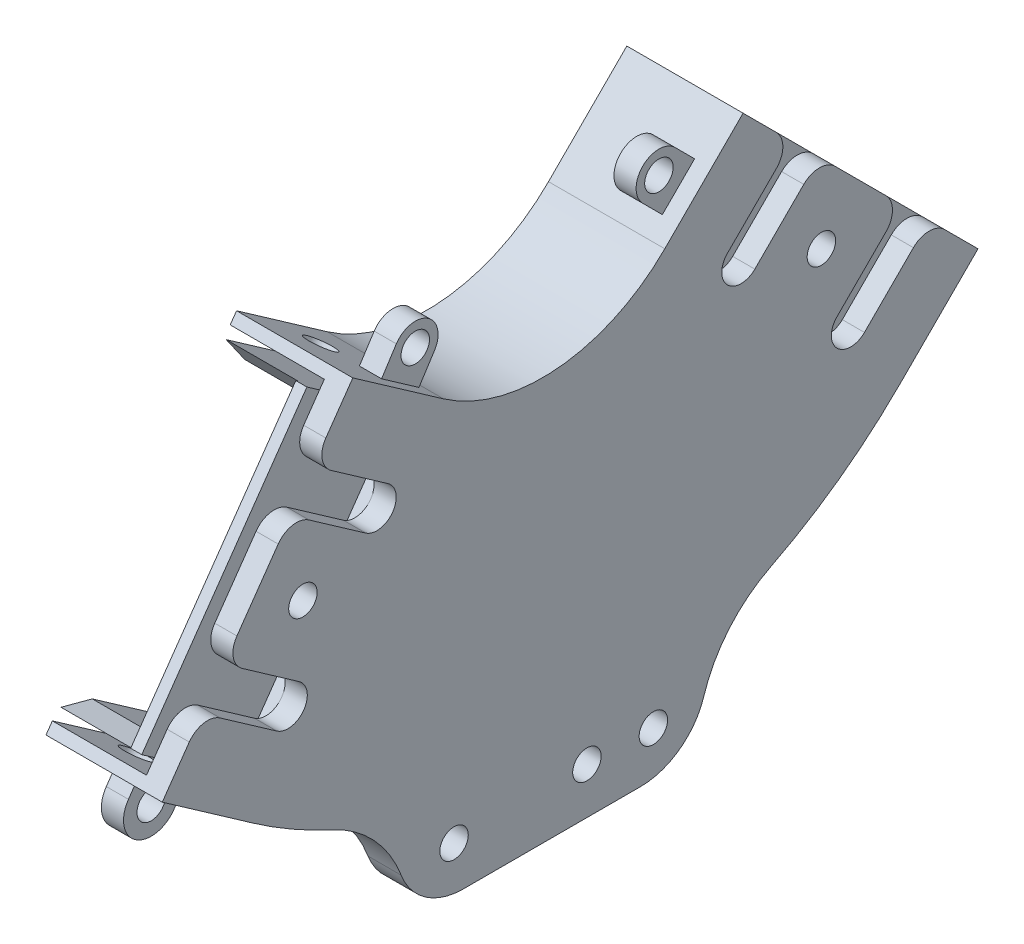
from build123d import *
from build123d.topology import SkipClean

# Parameters (mm, degrees)
BASE_EXTRUDE_DEPTH              = 58.42
BASE_EXTRUDE_2_DEPTH            = 58.42
OUTER_WALL_DEPTH                = 7.62
SKETCH6_W                       = 73.66
SKETCH6_H                       = 76.2
SKETCH6_W_2                     = 68.58
SKETCH6_H_2                     = 71.12
SKETCH6_W_3                     = 63.5
SKETCH6_H_3                     = 66.04
SKETCH6_W_4                     = 58.42
SKETCH6_H_4                     = 60.96
ENDCAP_1_DEPTH                  = 25.4
SKETCH7_W                       = 73.66
SKETCH7_H                       = 76.2
SKETCH7_W_2                     = 68.58
SKETCH7_H_2                     = 71.12
SKETCH7_W_3                     = 63.5
SKETCH7_H_3                     = 66.04
SKETCH7_W_4                     = 58.42
SKETCH7_H_4                     = 60.96
ENDCAP_2_DEPTH                  = 25.4
INTERNAL_CHAMFER_SIZE           = 2.773453185
INTERNAL_CHAMFER_SIZE_2         = 7.62
FLYWHEEL_HOLE_REACH             = 158.41
SKETCH10_W                      = 25.4
SKETCH10_H                      = 177.72143494
SKETCH11_R                      = 4.064
SKETCH11_R_2                    = 2.5
FLYWHEEL_HOLDER_DEPTH           = 7.62
SKETCH12_R                      = 14.605
MOTOR_INSERT_DEPTH              = 6.35
SKETCH14_W                      = 212.132210094
SKETCH14_H                      = 160.972819264
CUT_EXTRUDE2_DEPTH              = 49.53
SKETCH15_R                      = 3.2639
JOINING_SCREW_HOLES_DEPTH       = 5.08
SKETCH16_R                      = 3.2639
FLYWHEEL_COVER_CONNECTORS_DEPTH = 5.08
F_80_20_START                   = -5.08
SKETCH17_R                      = 3.2639
F_80_20_CONNECTOR_DEPTH         = 5.08
FILLET1_R                       = 30.48
FILLET2_R                       = 15.24
SUPPORT_REMOVAL_REACH           = 169.33
FILLET3_R                       = 5.08
CUT_EXTRUDE3_REACH              = 169.33
SKETCH19_R                      = 3.2639
CUT_EXTRUDE4_REACH              = 200.014
SKETCH20_R                      = 3.2639
CUT_EXTRUDE5_REACH              = 197.272
SKETCH21_R                      = 3.2639
SKETCH22_R                      = 3.2639
BOSS_EXTRUDE1_DEPTH             = 2.54


with BuildPart() as part:
    # Sketch3 → Base extrude (new body)
    with BuildSketch(Plane(origin=(0, 0, 0), x_dir=(0, 0, -1), z_dir=(1, 0, 0))):
        with BuildLine():
            Line((-62.063264719, -88.6355278), (-66.433917164, -94.877466378))
            ThreePointArc((-66.433917164, -94.877466378), (10.094726748, -115.383254712), (81.899935824, -81.899935824))
            Line((81.899935824, -81.899935824), (76.511782152, -76.511782152))
            ThreePointArc((76.511782152, -76.511782152), (9.430599988, -107.792251112), (-62.063264719, -88.6355278))
        make_face()
    extrude(amount=BASE_EXTRUDE_DEPTH)



with BuildPart() as body_2:
    # Sketch3 → Base extrude 2 (new body)
    with BuildSketch(Plane(origin=(0, 0, 0), x_dir=(0, 0, -1), z_dir=(1, 0, 0))):
        with BuildLine():
            ThreePointArc((28.018399098, -28.018399098), (3.453459151, -39.473218717), (-22.727392714, -32.458080603))
            Line((-22.727392714, -32.458080603), (-27.098045159, -38.70001918))
            ThreePointArc((-27.098045159, -38.70001918), (4.11758591, -47.064222317), (33.40655277, -33.40655277))
            Line((33.40655277, -33.40655277), (28.018399098, -28.018399098))
        make_face()
    extrude(amount=BASE_EXTRUDE_2_DEPTH)


with BuildPart() as part_1:
    add(part.part)

    add(body_2.part)  # Outer wall merges body 2
    # Sketch4 → Outer wall (add)
    with BuildSketch(Plane(origin=(58.42, 0, 0), x_dir=(0, 0, -1), z_dir=(1, 0, 0))):
        with BuildLine():
            Line((-66.433917164, -94.877466378), (-22.727392714, -32.458080603))
            ThreePointArc((-22.727392714, -32.458080603), (3.453459151, -39.473218717), (28.018399098, -28.018399098))
            Line((28.018399098, -28.018399098), (81.899935824, -81.899935824))
            ThreePointArc((81.899935824, -81.899935824), (10.094726748, -115.383254712), (-66.433917164, -94.877466378))
        make_face()
    outer_wall = extrude(amount=OUTER_WALL_DEPTH)

    # Mirror1: Outer wall across plane
    add(outer_wall.mirror(Plane.ZY.offset(-29.21)))

    # Sketch6 → Endcap 1 (add)
    # profile 1 of 2: a face of its own
    with BuildSketch(Plane(origin=(0, 0, 0), x_dir=(1, 0, 0), z_dir=(0, 0.5735764363510462, 0.8191520442889917))):
        with Locations((29.21, -77.724)):
            Rectangle(SKETCH6_W, SKETCH6_H)
        with Locations((29.21, -77.724)):
            Rectangle(SKETCH6_W_2, SKETCH6_H_2, mode=Mode.SUBTRACT)
    # profile 2 of 2: a face of its own
    with BuildSketch(Plane(origin=(0, 0, 0), x_dir=(1, 0, 0), z_dir=(0, 0.5735764363510462, 0.8191520442889917))):
        with Locations((29.21, -77.724)):
            Rectangle(SKETCH6_W_3, SKETCH6_H_3)
        with Locations((29.21, -77.724)):
            Rectangle(SKETCH6_W_4, SKETCH6_H_4, mode=Mode.SUBTRACT)
    extrude(amount=ENDCAP_1_DEPTH)

    # Sketch7 → Endcap 2 (add)
    # profile 1 of 2: a face of its own
    with BuildSketch(Plane(origin=(0, 0, 0), x_dir=(1, 0, 0), z_dir=(0, 0.7071067811865503, -0.7071067811865447))):
        with Locations((29.21, 77.724)):
            Rectangle(SKETCH7_W, SKETCH7_H)
        with Locations((29.21, 77.724)):
            Rectangle(SKETCH7_W_2, SKETCH7_H_2, mode=Mode.SUBTRACT)
    # profile 2 of 2: a face of its own
    with BuildSketch(Plane(origin=(0, 0, 0), x_dir=(1, 0, 0), z_dir=(0, 0.7071067811865503, -0.7071067811865447))):
        with Locations((29.21, 77.724)):
            Rectangle(SKETCH7_W_3, SKETCH7_H_3)
        with Locations((29.21, 77.724)):
            Rectangle(SKETCH7_W_4, SKETCH7_H_4, mode=Mode.SUBTRACT)
    extrude(amount=ENDCAP_2_DEPTH)

    # Internal Chamfer
    # the kernel refuses this chamfer: 7.62, 2.773453185 mm, written as the material it takes off along each edge
    with BuildSketch(Plane(origin=(58.42, -15.446040528, -51.367065013), x_dir=(0, 0.7736626875489875, 0.6335977003544738), z_dir=(-1, 0, 0)), Plane(origin=(0, -24.131177697, 47.904507084), x_dir=(0, 0.8719320989550161, -0.489626811778011), z_dir=(1, 0, 0))) as internal_chamfer_piece_1:
        Polygon((INTERNAL_CHAMFER_SIZE * 0.995083363221, -INTERNAL_CHAMFER_SIZE * 0.0990409022559), (-INTERNAL_CHAMFER_SIZE_2 * 0.0990409022521, -INTERNAL_CHAMFER_SIZE_2 * 0.995083363182), (0, 0), align=None)
    extrude(amount=58.42, mode=Mode.SUBTRACT)
    with BuildSketch(Plane(origin=(0, -58.551269909, -94.472294394), x_dir=(0, -0.6977227871251116, 0.7163678610367485), z_dir=(1, 0, 0)), Plane(origin=(58.42, -74.066686317, 82.869726644), x_dir=(0, -0.562726836605906, -0.8266429140587307), z_dir=(-1, 0, 0))) as internal_chamfer_piece_2:
        Polygon((INTERNAL_CHAMFER_SIZE_2 * 0.999913086528, INTERNAL_CHAMFER_SIZE_2 * 0.0131840581986), (-INTERNAL_CHAMFER_SIZE * 0.0131840581992, INTERNAL_CHAMFER_SIZE * 0.999913086567), (0, 0), align=None)
    extrude(amount=58.42, mode=Mode.SUBTRACT)

    # Sketch10 → Flywheel Hole (cut, up to next)
    with BuildSketch(Plane(origin=(0, -13.973562988, -1.22252835), x_dir=(-1, 0, 0), z_dir=(0, -0.9961946980917453, -0.08715574274766034)), mode=Mode.PRIVATE) as flywheel_hole_sk1:
        with Locations((-29.21, 6.675062398)):
            Rectangle(SKETCH10_W, SKETCH10_H)
    flywheel_hole_tool1 = extrude(flywheel_hole_sk1.sketch, amount=FLYWHEEL_HOLE_REACH, mode=Mode.PRIVATE) & part_1.part
    add(flywheel_hole_tool1.solids().sort_by_distance((29.21, -13.391793, -7.87219))[0], mode=Mode.SUBTRACT)

    # Sketch11 → Flywheel holder (add)
    with BuildSketch(Plane.ZY.offset(7.62)):
        with BuildLine():
            Line((-25.298191602, 2.271893855), (-28.018399098, -28.018399098))
            ThreePointArc((-28.018399098, -28.018399098), (-17.263469888, -35.665585421), (-4.593712298, -39.356818765))
            Line((-4.593712298, -39.356818765), (-3.063575879, -22.31830958))
            ThreePointArc((-3.063575879, -22.31830958), (1.55249301, -17.71209094), (6.899502357, -21.445029888))
            Line((6.899502357, -21.445029888), (11.370438714, -37.957535477))
            ThreePointArc((11.370438714, -37.957535477), (17.269236463, -35.662793609), (22.727392714, -32.458080603))
            Line((22.727392714, -32.458080603), (33.130623676, -25.173659861))
            Line((33.130623676, -25.173659861), (24.517199578, 6.638292315))
            ThreePointArc((24.517199578, 6.638292315), (-2.217847157, 25.302987057), (-25.298191602, 2.271893855))
        make_face()
        Circle(SKETCH11_R, mode=Mode.SUBTRACT)
        with Locations((-20.421702152, -1.789994753)):
            Circle(SKETCH11_R_2, mode=Mode.SUBTRACT)
        with Locations((20.421702152, 1.789994753)):
            Circle(SKETCH11_R_2, mode=Mode.SUBTRACT)
    extrude(amount=-FLYWHEEL_HOLDER_DEPTH)

    # Sketch12 → Motor insert (cut)
    with BuildSketch(Plane.ZY.offset(7.62)):
        Circle(SKETCH12_R)
    extrude(amount=-MOTOR_INSERT_DEPTH, mode=Mode.SUBTRACT)

    # Sketch14 → Cut-Extrude2 (cut)
    with BuildSketch(Plane.ZY.offset(7.62)):
        with Locations((-0.510154839, -39.532122181)):
            Rectangle(SKETCH14_W, SKETCH14_H)
    extrude(amount=-CUT_EXTRUDE2_DEPTH, mode=Mode.SUBTRACT)

    # Sketch15 → Joining screw holes (add)
    # profile 1 of 3: a face of its own
    with BuildSketch(Plane.ZY.offset(-41.91)):
        with BuildLine():
            Line((-89.621167975, -74.178703673), (-93.808320694, -77.730793631))
            ThreePointArc((-93.808320694, -77.730793631), (-94.293535912, -86.957846302), (-85.053908121, -86.901162291))
            Line((-85.053908121, -86.901162291), (-80.631239272, -83.149276783))
            ThreePointArc((-80.631239272, -83.149276783), (-81.267988364, -82.527044314), (-81.899935824, -81.899935824))
            Line((-81.899935824, -81.899935824), (-89.621167975, -74.178703673))
        make_face()
        with Locations(Location((-89.700448066, -82.573094993, 0), (0, 0, 270))):
            Circle(SKETCH15_R, mode=Mode.SUBTRACT)
    # profile 2 of 3: a face of its own
    with BuildSketch(Plane.ZY.offset(-41.91)):
        with BuildLine():
            ThreePointArc((-3.85934265, -115.759684045), (-10.200012116, -115.373995029), (-16.51, -114.641261664))
            Line((-16.51, -114.641261664), (-16.51, -121.49592915))
            ThreePointArc((-16.51, -121.49592915), (-9.764193336, -127.833581482), (-3.85934265, -120.705855126))
            Line((-3.85934265, -120.705855126), (-3.85934265, -115.759684045))
        make_face()
        with Locations(Location((-10.16, -121.49592915, 0), (0, 0, 270))):
            Circle(SKETCH15_R, mode=Mode.SUBTRACT)
    # profile 3 of 3: a face of its own
    with BuildSketch(Plane.ZY.offset(-41.91)):
        with BuildLine():
            ThreePointArc((66.433917164, -94.877466378), (62.923155577, -97.241325928), (59.32837287, -99.475339399))
            Line((59.32837287, -99.475339399), (62.868028779, -104.530491931))
            Line((62.868028779, -104.530491931), (63.115503756, -104.883922825))
            ThreePointArc((63.115503756, -104.883922825), (71.906047644, -106.216498213), (73.412285238, -97.454040377))
            Line((73.412285238, -97.454040377), (73.371541167, -97.395851813))
            Line((73.371541167, -97.395851813), (69.905878638, -92.446372781))
            Line((69.905878638, -92.446372781), (66.433917164, -94.877466378))
        make_face()
        with Locations(Location((68.190379089, -101.067099492, 0), (0, 0, 270))):
            Circle(SKETCH15_R, mode=Mode.SUBTRACT)
    extrude(amount=-JOINING_SCREW_HOLES_DEPTH)

    # Sketch16 → Flywheel cover connectors (add)
    # profile 1 of 2: a face of its own
    with BuildSketch(Plane(origin=(59.69, 0, 0), x_dir=(0, 0, -1), z_dir=(1, 0, 0))):
        with BuildLine():
            ThreePointArc((-21.17939876, -25.923451894), (-22.40017027, -18.550581346), (-29.745930764, -19.925101608))
            Line((-29.745930764, -19.925101608), (-33.130623676, -25.173659861))
            Line((-33.130623676, -25.173659861), (-24.564091672, -31.172010147))
            Line((-24.564091672, -31.172010147), (-21.17939876, -25.923451894))
        make_face()
        with Locations((-25.4, -22.834782196)):
            Circle(SKETCH16_R, mode=Mode.SUBTRACT)
    # profile 2 of 2: a face of its own
    with BuildSketch(Plane(origin=(59.69, 0, 0), x_dir=(0, 0, -1), z_dir=(1, 0, 0))):
        with BuildLine():
            Line((26.781800754, -20.274741321), (31.271928814, -24.764869381))
            Line((31.271928814, -24.764869381), (38.668327307, -17.368470889))
            Line((38.668327307, -17.368470889), (34.178199246, -12.878342828))
            ThreePointArc((34.178199246, -12.878342828), (26.781800754, -12.878342828), (26.781800754, -20.274741321))
        make_face()
        with Locations((30.48, -16.576542074)):
            Circle(SKETCH16_R, mode=Mode.SUBTRACT)
    extrude(amount=FLYWHEEL_COVER_CONNECTORS_DEPTH)

    # Sketch17 → 80-20 connector (add)
    with BuildSketch(Plane(origin=(66.04, 0, 0), x_dir=(0, 0, -1), z_dir=(1, 0, 0)).offset(F_80_20_START)):
        with BuildLine():
            Line((-30.48, -111.741525746), (-30.48, -132.08))
            Line((-30.48, -132.08), (35.56, -132.08))
            Line((35.56, -132.08), (35.56, -110.23014731))
            ThreePointArc((35.56, -110.23014731), (2.650031357, -115.793679922), (-30.48, -111.741525746))
        make_face()
        with Locations((-20.32, -121.92)):
            Circle(SKETCH17_R, mode=Mode.SUBTRACT)
        with Locations((25.4, -121.92)):
            Circle(SKETCH17_R, mode=Mode.SUBTRACT)
        with Locations(Location((10.16, -121.49592915, 0), (0, 0, 270))):
            Circle(SKETCH17_R, mode=Mode.SUBTRACT)
    extrude(amount=F_80_20_CONNECTOR_DEPTH)

    # Fillet1
    # the kernel refuses this fillet: 30.48 mm, written as the material it adds along each edge
    with BuildSketch(Plane(origin=(60.96, -111.741525746, 30.48), x_dir=(0, 0.341001357032678, 0.9400628034880818), z_dir=(1, 0, 0))) as fillet1_piece_1:
        with BuildLine():
            CenterArc((21.388873665, 30.3783614), FILLET1_R, 201.677822045, 63.641807356)
            Line((-6.935447321, 19.119443126), (-7.50193374, 18.894264761))
            ThreePointArc((-7.50193374, 18.894264761), (-4.040785945, 9.351847136), (-0.573062285, -0.207874427))
            Line((-0.573062285, -0.207874427), (0.049741567, -0.607567228))
            ThreePointArc((0.049741567, -0.607567228), (9.450897666, -0.223373321), (18.852053765, -0.607567228))
            Line((18.852053765, -0.607567228), (18.901795332, 0))
        make_face()
    extrude(amount=5.08)
    with BuildSketch(Plane(origin=(60.96, -110.23014731, -35.56), x_dir=(0, 0.38036360514981254, -0.9248370277391782), z_dir=(1, 0, 0))) as fillet1_piece_2:
        with BuildLine():
            CenterArc((20.459697652, -30.38701358), FILLET1_R, 94.47662158, 63.167171408)
            Line((-7.729334953, -18.793530895), (-8.293115606, -18.561661241))
            Line((-8.293115606, -18.561661241), (-0.563780652, 0.231869654))
            Line((-0.563780652, 0.231869654), (0.047580692, 0.607740272))
            ThreePointArc((0.047580692, 0.607740272), (9.040331521, 0.256251605), (18.033082349, 0.607740272))
            Line((18.033082349, 0.607740272), (18.080663041, 0))
        make_face()
    extrude(amount=5.08)

    # Fillet2
    fillet2_edges = [part_1.edges().sort_by_distance(p)[0] for p in [
        (63.5, -132.08, -35.56),
        (63.5, -132.08, 30.48),
    ]]
    fillet(fillet2_edges, radius=FILLET2_R)

    # Sketch18 → Support Removal (cut, up to next)
    with BuildSketch(Plane(origin=(66.04, 0, 0), x_dir=(0, 0, -1), z_dir=(1, 0, 0)), mode=Mode.PRIVATE) as support_removal_sk1:
        with BuildLine():
            Line((-35.474049478, -42.912572046), (-52.639380566, -30.893277823))
            Line((-52.639380566, -30.893277823), (-57.738475085, -38.175539496))
            Line((-57.738475085, -38.175539496), (-40.573143997, -50.19483372))
            ThreePointArc((-40.573143997, -50.19483372), (-34.382465901, -49.103250143), (-35.474049478, -42.912572046))
        make_face()
    support_removal_tool1 = extrude(support_removal_sk1.sketch, amount=-SUPPORT_REMOVAL_REACH, mode=Mode.PRIVATE) & part_1.part
    # Sketch18 → Support Removal (cut, up to next)
    with BuildSketch(Plane(origin=(66.04, 0, 0), x_dir=(0, 0, -1), z_dir=(1, 0, 0)), mode=Mode.PRIVATE) as support_removal_sk2:
        with BuildLine():
            Line((-55.870427555, -72.041618741), (-73.035758643, -60.022324518))
            Line((-73.035758643, -60.022324518), (-78.134853162, -67.304586191))
            Line((-78.134853162, -67.304586191), (-60.969522074, -79.323880415))
            ThreePointArc((-60.969522074, -79.323880415), (-54.778843977, -78.232296838), (-55.870427555, -72.041618741))
        make_face()
    support_removal_tool2 = extrude(support_removal_sk2.sketch, amount=-SUPPORT_REMOVAL_REACH, mode=Mode.PRIVATE) & part_1.part
    # Sketch18 → Support Removal (cut, up to next)
    with BuildSketch(Plane(origin=(66.04, 0, 0), x_dir=(0, 0, -1), z_dir=(1, 0, 0)), mode=Mode.PRIVATE) as support_removal_sk3:
        with BuildLine():
            Line((42.386808891, -36.100629607), (57.204231491, -21.283207007))
            Line((57.204231491, -21.283207007), (63.490410776, -27.569386292))
            Line((63.490410776, -27.569386292), (48.672988176, -42.386808891))
            ThreePointArc((48.672988176, -42.386808891), (42.386808891, -42.386808891), (42.386808891, -36.100629607))
        make_face()
    support_removal_tool3 = extrude(support_removal_sk3.sketch, amount=-SUPPORT_REMOVAL_REACH, mode=Mode.PRIVATE) & part_1.part
    # Sketch18 → Support Removal (cut, up to next)
    with BuildSketch(Plane(origin=(66.04, 0, 0), x_dir=(0, 0, -1), z_dir=(1, 0, 0)), mode=Mode.PRIVATE) as support_removal_sk4:
        with BuildLine():
            Line((67.53152603, -61.245346746), (82.34894863, -46.427924146))
            Line((82.34894863, -46.427924146), (88.635127915, -52.714103431))
            Line((88.635127915, -52.714103431), (73.817705315, -67.53152603))
            ThreePointArc((73.817705315, -67.53152603), (67.53152603, -67.53152603), (67.53152603, -61.245346746))
        make_face()
    support_removal_tool4 = extrude(support_removal_sk4.sketch, amount=-SUPPORT_REMOVAL_REACH, mode=Mode.PRIVATE) & part_1.part
    add(support_removal_tool1.solids().sort_by_distance((66.04, -41.556808, 45.159903))[0], mode=Mode.SUBTRACT)
    add(support_removal_tool2.solids().sort_by_distance((66.04, -70.685854, 65.556281))[0], mode=Mode.SUBTRACT)
    add(support_removal_tool3.solids().sort_by_distance((66.04, -33.083531, -51.690086))[0], mode=Mode.SUBTRACT)
    add(support_removal_tool4.solids().sort_by_distance((66.04, -58.228249, -76.834803))[0], mode=Mode.SUBTRACT)

    # Fillet3
    fillet3_edges = [part_1.edges().sort_by_distance(p)[0] for p in [
        (64.77, -46.427924146, -82.34894863),
        (64.77, -52.714103431, -88.635127915),
        (64.77, -21.283207007, -57.204231491),
        (64.77, -27.569386292, -63.490410776),
        (64.77, -67.304586191, 78.134853162),
        (64.77, -60.022324518, 73.035758643),
        (64.77, -38.175539496, 57.738475085),
        (64.77, -30.893277823, 52.639380566),
    ]]
    fillet(fillet3_edges, radius=FILLET3_R)

    # Sketch19 → Cut-Extrude3 (cut, up to next)
    with BuildSketch(Plane(origin=(66.04, 0, 0), x_dir=(0, 0, -1), z_dir=(1, 0, 0)), mode=Mode.PRIVATE) as cut_extrude3_sk1:
        with Locations((63.939423582, -45.97891134)):
            Circle(SKETCH19_R)
    cut_extrude3_tool1 = extrude(cut_extrude3_sk1.sketch, amount=-CUT_EXTRUDE3_REACH, mode=Mode.PRIVATE) & part_1.part
    # Sketch19 → Cut-Extrude3 (cut, up to next)
    with BuildSketch(Plane(origin=(66.04, 0, 0), x_dir=(0, 0, -1), z_dir=(1, 0, 0)), mode=Mode.PRIVATE) as cut_extrude3_sk2:
        with Locations((-54.983885901, -56.383352749)):
            Circle(SKETCH19_R)
    cut_extrude3_tool2 = extrude(cut_extrude3_sk2.sketch, amount=-CUT_EXTRUDE3_REACH, mode=Mode.PRIVATE) & part_1.part
    add(cut_extrude3_tool1.solids().sort_by_distance((66.04, -45.978911, -63.939424))[0], mode=Mode.SUBTRACT)
    add(cut_extrude3_tool2.solids().sort_by_distance((66.04, -56.383353, 54.983886))[0], mode=Mode.SUBTRACT)

    # Sketch20 → Cut-Extrude4 (cut, up to next)
    with BuildSketch(Plane(origin=(0, -94.877466378, 66.433917164), x_dir=(1, 0, 0), z_dir=(0, -0.8191520442889918, 0.5735764363510464)), mode=Mode.PRIVATE) as cut_extrude4_sk1:
        with Locations(Location((50.8, 12.7, 0), (0, 0, 270))):
            Circle(SKETCH20_R)
    cut_extrude4_tool1 = extrude(cut_extrude4_sk1.sketch, amount=-CUT_EXTRUDE4_REACH, mode=Mode.PRIVATE) & part_1.part
    cut_extrude4 = cut_extrude4_tool1.solids().sort_by_distance((50.8, -87.593046, 76.837148))[0]
    add(cut_extrude4, mode=Mode.SUBTRACT)

    # Mirror2: Cut-Extrude4 across plane
    add(cut_extrude4.mirror(Plane(origin=(0, -63.66777349, 44.580654939), x_dir=(0, 0.5735764363510465, 0.8191520442889916), z_dir=(0, 0.8191520442889918, -0.5735764363510464))), mode=Mode.SUBTRACT)

    # Sketch21 → Cut-Extrude5 (cut, up to next)
    with BuildSketch(Plane(origin=(0, -81.899935824, -81.899935824), x_dir=(1, 0, 0), z_dir=(0, -0.7071067811865449, -0.7071067811865501)), mode=Mode.PRIVATE) as cut_extrude5_sk1:
        with Locations(Location((50.8, -12.7, 0), (0, 0, 270))):
            Circle(SKETCH21_R)
    cut_extrude5_tool1 = extrude(cut_extrude5_sk1.sketch, amount=-CUT_EXTRUDE5_REACH, mode=Mode.PRIVATE) & part_1.part
    add(cut_extrude5_tool1.solids().sort_by_distance((50.8, -72.91968, -90.880192))[0], mode=Mode.SUBTRACT)

    # Sketch22 → Boss-Extrude1 (add)
    with SkipClean():  # the faces are left unmerged after this step: merging them gives an invalid solid
        with BuildSketch(Plane(origin=(66.04, 0, 0), x_dir=(0, 0, -1), z_dir=(1, 0, 0))):
            with BuildLine():
                Line((99.860448066, -63.939423582), (92.227230363, -56.306205879))
                ThreePointArc((92.227230363, -56.306205879), (88.635127915, -54.818308328), (85.043025467, -56.306205879))
                Line((85.043025467, -56.306205879), (73.817705315, -67.53152603))
                ThreePointArc((73.817705315, -67.53152603), (67.53152603, -67.53152603), (67.53152603, -61.245346746))
                Line((67.53152603, -61.245346746), (78.756846182, -50.020026594))
                ThreePointArc((78.756846182, -50.020026594), (80.244743733, -46.427924146), (78.756846182, -42.835821697))
                Line((78.756846182, -42.835821697), (67.082513224, -31.16148874))
                ThreePointArc((67.082513224, -31.16148874), (63.490410776, -29.673591189), (59.898308328, -31.16148874))
                Line((59.898308328, -31.16148874), (48.672988176, -42.386808891))
                ThreePointArc((48.672988176, -42.386808891), (42.386808891, -42.386808891), (42.386808891, -36.100629607))
                Line((42.386808891, -36.100629607), (53.612129043, -24.875309455))
                ThreePointArc((53.612129043, -24.875309455), (55.100026594, -21.283207007), (53.612129043, -17.691104559))
                Line((53.612129043, -17.691104559), (45.97891134, -10.057886856))
                Line((45.97891134, -10.057886856), (28.018399098, -28.018399098))
                ThreePointArc((28.018399098, -28.018399098), (3.453459151, -39.473218717), (-22.727392714, -32.458080603))
                Line((-22.727392714, -32.458080603), (-43.533854639, -17.88923912))
                Line((-43.533854639, -17.88923912), (-49.725612269, -26.731985438))
                ThreePointArc((-49.725612269, -26.731985438), (-50.56714327, -30.527886477), (-48.478088181, -33.807046119))
                Line((-48.478088181, -33.807046119), (-35.474049478, -42.912572046))
                ThreePointArc((-35.474049478, -42.912572046), (-34.382465901, -49.103250143), (-40.573143997, -50.19483372))
                Line((-40.573143997, -50.19483372), (-53.5771827, -41.089307793))
                ThreePointArc((-53.5771827, -41.089307793), (-57.373083739, -40.247776793), (-60.652243382, -42.336831881))
                Line((-60.652243382, -42.336831881), (-70.121990346, -55.861032133))
                ThreePointArc((-70.121990346, -55.861032133), (-70.963521346, -59.656933172), (-68.874466258, -62.936092814))
                Line((-68.874466258, -62.936092814), (-55.870427555, -72.041618741))
                ThreePointArc((-55.870427555, -72.041618741), (-54.778843977, -78.232296838), (-60.969522074, -79.323880415))
                Line((-60.969522074, -79.323880415), (-73.973560777, -70.218354488))
                ThreePointArc((-73.973560777, -70.218354488), (-77.769461816, -69.376823488), (-81.048621458, -71.465878576))
                Line((-81.048621458, -71.465878576), (-87.240379089, -80.308624894))
                Line((-87.240379089, -80.308624894), (-66.433917164, -94.877466378))
                ThreePointArc((-66.433917164, -94.877466378), (-57.577531083, -100.498889996), (-48.248874711, -105.295987887))
                ThreePointArc((-48.248874711, -105.295987887), (-38.670234972, -112.201058525), (-32.434769037, -122.228486128))
                ThreePointArc((-32.434769037, -122.228486128), (-26.843390099, -129.377506303), (-18.179180054, -132.08))
                Line((-18.179180054, -132.08), (22.424345917, -132.08))
                ThreePointArc((22.424345917, -132.08), (31.441147567, -129.12637001), (36.962897278, -121.410352757))
                ThreePointArc((36.962897278, -121.410352757), (42.797014935, -110.8331972), (52.281666667, -103.352921132))
                ThreePointArc((52.281666667, -103.352921132), (67.94286759, -93.802802301), (81.899935824, -81.899935824))
                Line((81.899935824, -81.899935824), (99.860448066, -63.939423582))
            make_face()
            with Locations((-54.983885901, -56.383352749)):
                Circle(SKETCH22_R, mode=Mode.SUBTRACT)
            with Locations((-20.32, -121.92)):
                Circle(SKETCH22_R, mode=Mode.SUBTRACT)
            with Locations(Location((10.16, -121.49592915, 0), (0, 0, 270))):
                Circle(SKETCH22_R, mode=Mode.SUBTRACT)
            with Locations((25.4, -121.92)):
                Circle(SKETCH22_R, mode=Mode.SUBTRACT)
            with Locations((63.939423582, -45.97891134)):
                Circle(SKETCH22_R, mode=Mode.SUBTRACT)
        extrude(amount=BOSS_EXTRUDE1_DEPTH)


solid = part_1.part
